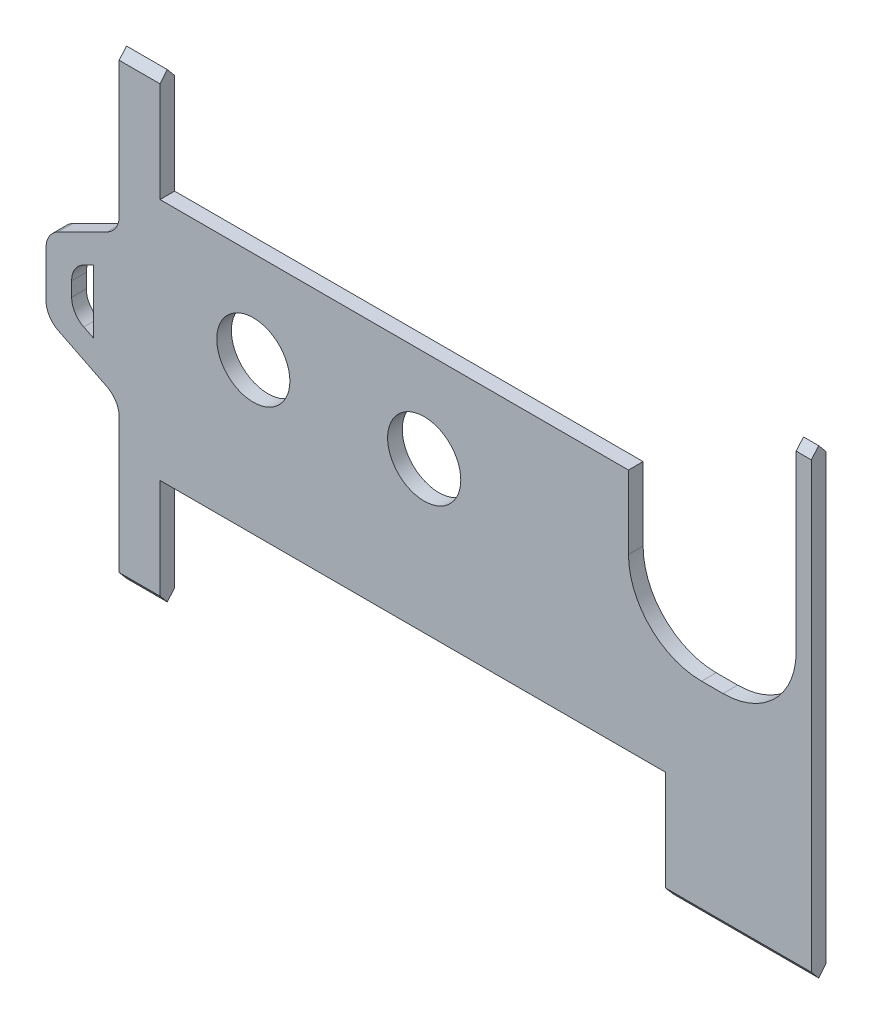
from build123d import *

# Parameters (mm, degrees)
SKETCH1_R           = 5
BOSS_EXTRUDE1_DEPTH = 1
CUT_EXTRUDE1_DEPTH  = 161.061343452
FILLET1_R           = 10
FILLET2_R           = 3


with BuildPart() as part:
    # Sketch1 → Boss-Extrude1 (new, symmetric)
    with BuildSketch(Plane.XY.offset(11.1483132)):
        Polygon((12.423, 91.8975), (22.423, 86.8975), (22.423, 65.272), (28.004353293, 65.272), (28.004353293, 80.272), (97.122940581, 80.272), (97.122940581, 65.272), (117.048, 65.272), (117.048, 128.523), (114.975774521, 128.523), (114.975774521, 93.523), (92.048, 93.523), (92.048, 113.523), (28.004353293, 113.523), (28.004353293, 128.523), (22.423, 128.523), (22.423, 106.8975), (12.423, 101.8975), align=None)
        Polygon((18.923, 92.560618961), (15.923, 94.060618961), (15.923, 99.734381039), (18.923, 101.234381039), align=None, mode=Mode.SUBTRACT)
        with Locations((64.122810805, 100.881519454)):
            Circle(SKETCH1_R, mode=Mode.SUBTRACT)
        with Locations((40.75880907, 100.906977446)):
            Circle(SKETCH1_R, mode=Mode.SUBTRACT)
    extrude(amount=BOSS_EXTRUDE1_DEPTH, both=True)

    # Sketch2 → Cut-Extrude1 (cut, through all)
    with BuildSketch(Plane.ZY.offset(-22.423)):
        Polygon((10.101339955, 128.523), (10.101339955, 127.168225732), (11.1483132, 128.412378938), (12.195286445, 127.168225732), (12.195286445, 128.523), align=None)
        Polygon((12.195286445, 66.626774268), (12.195286445, 65.272), (10.101339955, 65.272), (10.101339955, 66.626774268), (11.1483132, 65.382621062), align=None)
    extrude(amount=-CUT_EXTRUDE1_DEPTH, mode=Mode.SUBTRACT)

    # Fillet1
    fillet1_edges = [part.edges().sort_by_distance(p)[0] for p in [
        (92.048, 93.523, 11.1483132),
        (114.975774521, 93.523, 11.1483132),
    ]]
    fillet(fillet1_edges, radius=FILLET1_R)

    # Fillet2
    fillet2_edges = [part.edges().sort_by_distance(p)[0] for p in [
        (15.923, 99.734381039, 11.1483132),
        (15.923, 94.060618961, 11.1483132),
        (22.423, 106.8975, 11.1483132),
        (12.423, 101.8975, 11.1483132),
        (12.423, 91.8975, 11.1483132),
        (22.423, 86.8975, 11.1483132),
    ]]
    fillet(fillet2_edges, radius=FILLET2_R)


solid = part.part
